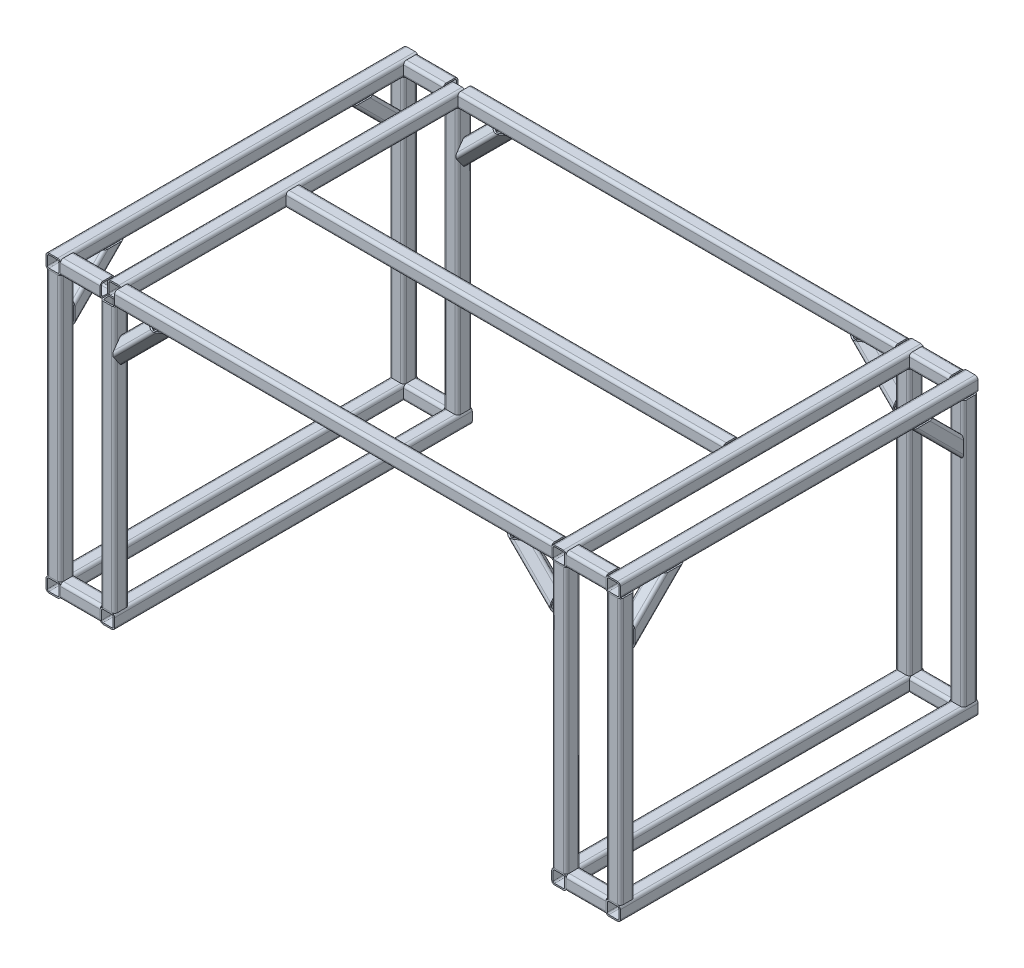
from build123d import *

# Parameters (mm, degrees)
SM_01_LOWER_FRAME_DEPTH         = 485
SM_01_LOWER_FRAME_DEPTH_BACK    = 10
SM_01_LOWER_FRAME_2_DEPTH       = 495
SM_01_LOWER_FRAME_3_DEPTH       = 77
SM_01_LOWER_FRAME_4_DEPTH       = 77
SM_01_LOWER_FRAME_5_DEPTH       = 495
SM_01_LOWER_FRAME_6_DEPTH       = 495
SM_01_LOWER_FRAME_7_DEPTH       = 77
SM_01_LOWER_FRAME_8_DEPTH       = 77
SM_02_UPPER_FRAME_START         = -247.5
SM_02_UPPER_FRAME_DEPTH         = 495
SM_02_UPPER_FRAME_START_2       = -377.5
SM_02_UPPER_FRAME_2_DEPTH       = 55
SM_02_UPPER_FRAME_3_DEPTH       = 55
SM_02_UPPER_FRAME_START_3       = 322.5
SM_02_UPPER_FRAME_4_DEPTH       = 55
SM_02_UPPER_FRAME_START_4       = -302.5
SM_02_UPPER_FRAME_5_DEPTH       = 605
SM_02_UPPER_FRAME_6_DEPTH       = 55
SM_02_UPPER_FRAME_7_DEPTH       = 495
SM_02_UPPER_FRAME_START_5       = -237.5
SM_02_UPPER_FRAME_8_DEPTH       = 475
SM_02_UPPER_FRAME_START_6       = -227.5
SM_02_UPPER_FRAME_9_DEPTH       = 455
SM_02_UPPER_FRAME_10_DEPTH      = 615
SM_02_UPPER_FRAME_11_DEPTH      = 615
SM_03_VERTICAL_SUPPORTS_DEPTH   = 387.5
SM_03_VERTICAL_SUPPORTS_2_DEPTH = 387.5
SM_03_VERTICAL_SUPPORTS_3_DEPTH = 387.5
SM_03_VERTICAL_SUPPORTS_4_DEPTH = 387.5
SM_03_VERTICAL_SUPPORTS_5_DEPTH = 387.5
SM_03_VERTICAL_SUPPORTS_6_DEPTH = 387.5
SM_03_VERTICAL_SUPPORTS_7_DEPTH = 387.5
SM_03_VERTICAL_SUPPORTS_8_DEPTH = 387.5
TR_04_EXTEND_1_RUN_ON           = 20
TR_04_EXTEND_1_OTHER_END_RUN_ON = 20
SM_04_UPPER_BRACES_START        = -106.066017178
SM_04_UPPER_BRACES_DEPTH        = 106.066017178
SM_04_UPPER_BRACES_2_DEPTH      = 106.066017178
SM_04_UPPER_BRACES_3_DEPTH      = 106.066017178
SM_04_UPPER_BRACES_4_DEPTH      = 106.066017178
SM_04_UPPER_BRACES_START_2      = 53.033008589
SM_04_UPPER_BRACES_5_DEPTH      = 106.066017178
SM_04_UPPER_BRACES_6_DEPTH      = 106.066017178
SM_04_UPPER_BRACES_7_DEPTH      = 106.066017178
SM_04_UPPER_BRACES_8_DEPTH      = 106.066017178


with BuildPart() as part:
    # Sketch1 → SM_01_Lower_Frame (new, two sides: drawn at the far end of the back side and taken through both)
    with BuildSketch(Plane(origin=(-387.5, 0, 237.5), x_dir=(-1, 0, 0), z_dir=(0, 0, -1)).offset(-SM_01_LOWER_FRAME_DEPTH_BACK)):
        with BuildLine():
            Line((-6, -10), (6, -10))
            ThreePointArc((6, -10), (8.828427125, -8.828427125), (10, -6))
            Line((10, -6), (10, 6))
            ThreePointArc((10, 6), (8.828427125, 8.828427125), (6, 10))
            Line((6, 10), (-6, 10))
            ThreePointArc((-6, 10), (-8.828427125, 8.828427125), (-10, 6))
            Line((-10, 6), (-10, -6))
            ThreePointArc((-10, -6), (-8.828427125, -8.828427125), (-6, -10))
        make_face()
        with BuildLine():
            Line((-6, -8), (6, -8))
            ThreePointArc((6, -8), (7.414213562, -7.414213562), (8, -6))
            Line((8, -6), (8, 6))
            ThreePointArc((8, 6), (7.414213562, 7.414213562), (6, 8))
            Line((6, 8), (-6, 8))
            ThreePointArc((-6, 8), (-7.414213562, 7.414213562), (-8, 6))
            Line((-8, 6), (-8, -6))
            ThreePointArc((-8, -6), (-7.414213562, -7.414213562), (-6, -8))
        make_face(mode=Mode.SUBTRACT)
    extrude(amount=SM_01_LOWER_FRAME_DEPTH + SM_01_LOWER_FRAME_DEPTH_BACK)


with BuildPart() as body_2:
    # Sketch1 on segment 2 (carried to segment 2) → SM_01_Lower_Frame 2 (new body)
    with BuildSketch(Plane(origin=(-312.5, 0, 247.5), x_dir=(-1, 0, 0), z_dir=(0, 0, -1))):
        with BuildLine():
            Line((-6, -10), (6, -10))
            ThreePointArc((6, -10), (8.828427125, -8.828427125), (10, -6))
            Line((10, -6), (10, 6))
            ThreePointArc((10, 6), (8.828427125, 8.828427125), (6, 10))
            Line((6, 10), (-6, 10))
            ThreePointArc((-6, 10), (-8.828427125, 8.828427125), (-10, 6))
            Line((-10, 6), (-10, -6))
            ThreePointArc((-10, -6), (-8.828427125, -8.828427125), (-6, -10))
        make_face()
        with BuildLine():
            Line((-6, -8), (6, -8))
            ThreePointArc((6, -8), (7.414213562, -7.414213562), (8, -6))
            Line((8, -6), (8, 6))
            ThreePointArc((8, 6), (7.414213562, 7.414213562), (6, 8))
            Line((6, 8), (-6, 8))
            ThreePointArc((-6, 8), (-7.414213562, 7.414213562), (-8, 6))
            Line((-8, 6), (-8, -6))
            ThreePointArc((-8, -6), (-7.414213562, -7.414213562), (-6, -8))
        make_face(mode=Mode.SUBTRACT)
    extrude(amount=SM_01_LOWER_FRAME_2_DEPTH)


with BuildPart() as body_3:
    # Sketch1 on segment 3 (carried to segment 3) → SM_01_Lower_Frame 3 (new body)
    with BuildSketch(Plane(origin=(-388.5, 0, 237.5), x_dir=(0, 0, -1), z_dir=(1, 0, 0))):
        with BuildLine():
            Line((-6, -10), (6, -10))
            ThreePointArc((6, -10), (8.828427125, -8.828427125), (10, -6))
            Line((10, -6), (10, 6))
            ThreePointArc((10, 6), (8.828427125, 8.828427125), (6, 10))
            Line((6, 10), (-6, 10))
            ThreePointArc((-6, 10), (-8.828427125, 8.828427125), (-10, 6))
            Line((-10, 6), (-10, -6))
            ThreePointArc((-10, -6), (-8.828427125, -8.828427125), (-6, -10))
        make_face()
        with BuildLine():
            Line((-6, -8), (6, -8))
            ThreePointArc((6, -8), (7.414213562, -7.414213562), (8, -6))
            Line((8, -6), (8, 6))
            ThreePointArc((8, 6), (7.414213562, 7.414213562), (6, 8))
            Line((6, 8), (-6, 8))
            ThreePointArc((-6, 8), (-7.414213562, 7.414213562), (-8, 6))
            Line((-8, 6), (-8, -6))
            ThreePointArc((-8, -6), (-7.414213562, -7.414213562), (-6, -8))
        make_face(mode=Mode.SUBTRACT)
    extrude(amount=SM_01_LOWER_FRAME_3_DEPTH)

    # SM_01_Lower_Frame 3 end butt 1
    split(bisect_by=Plane(origin=(-377.5, 0, 237.5), x_dir=(0, 1, 0), z_dir=(1, 0, 0)), keep=Keep.TOP)

    # SM_01_Lower_Frame 3 end butt 2
    split(bisect_by=Plane(origin=(-322.5, 0, 237.5), x_dir=(0, -1, 0), z_dir=(-1, 0, 0)), keep=Keep.TOP)


with BuildPart() as body_4:
    # Sketch1 on segment 4 (carried to segment 4) → SM_01_Lower_Frame 4 (new body)
    with BuildSketch(Plane(origin=(-388.5, 0, -237.5), x_dir=(0, 0, -1), z_dir=(1, 0, 0))):
        with BuildLine():
            Line((-6, -10), (6, -10))
            ThreePointArc((6, -10), (8.828427125, -8.828427125), (10, -6))
            Line((10, -6), (10, 6))
            ThreePointArc((10, 6), (8.828427125, 8.828427125), (6, 10))
            Line((6, 10), (-6, 10))
            ThreePointArc((-6, 10), (-8.828427125, 8.828427125), (-10, 6))
            Line((-10, 6), (-10, -6))
            ThreePointArc((-10, -6), (-8.828427125, -8.828427125), (-6, -10))
        make_face()
        with BuildLine():
            Line((-6, -8), (6, -8))
            ThreePointArc((6, -8), (7.414213562, -7.414213562), (8, -6))
            Line((8, -6), (8, 6))
            ThreePointArc((8, 6), (7.414213562, 7.414213562), (6, 8))
            Line((6, 8), (-6, 8))
            ThreePointArc((-6, 8), (-7.414213562, 7.414213562), (-8, 6))
            Line((-8, 6), (-8, -6))
            ThreePointArc((-8, -6), (-7.414213562, -7.414213562), (-6, -8))
        make_face(mode=Mode.SUBTRACT)
    extrude(amount=SM_01_LOWER_FRAME_4_DEPTH)

    # SM_01_Lower_Frame 4 end butt 1
    split(bisect_by=Plane(origin=(-377.5, 0, -237.5), x_dir=(0, 1, 0), z_dir=(1, 0, 0)), keep=Keep.TOP)

    # SM_01_Lower_Frame 4 end butt 2
    split(bisect_by=Plane(origin=(-322.5, 0, -237.5), x_dir=(0, -1, 0), z_dir=(-1, 0, 0)), keep=Keep.TOP)


with BuildPart() as body_5:
    # Sketch1 on segment 5 (carried to segment 5) → SM_01_Lower_Frame 5 (new body)
    with BuildSketch(Plane(origin=(312.5, 0, 247.5), x_dir=(-1, 0, 0), z_dir=(0, 0, -1))):
        with BuildLine():
            Line((-6, -10), (6, -10))
            ThreePointArc((6, -10), (8.828427125, -8.828427125), (10, -6))
            Line((10, -6), (10, 6))
            ThreePointArc((10, 6), (8.828427125, 8.828427125), (6, 10))
            Line((6, 10), (-6, 10))
            ThreePointArc((-6, 10), (-8.828427125, 8.828427125), (-10, 6))
            Line((-10, 6), (-10, -6))
            ThreePointArc((-10, -6), (-8.828427125, -8.828427125), (-6, -10))
        make_face()
        with BuildLine():
            Line((-6, -8), (6, -8))
            ThreePointArc((6, -8), (7.414213562, -7.414213562), (8, -6))
            Line((8, -6), (8, 6))
            ThreePointArc((8, 6), (7.414213562, 7.414213562), (6, 8))
            Line((6, 8), (-6, 8))
            ThreePointArc((-6, 8), (-7.414213562, 7.414213562), (-8, 6))
            Line((-8, 6), (-8, -6))
            ThreePointArc((-8, -6), (-7.414213562, -7.414213562), (-6, -8))
        make_face(mode=Mode.SUBTRACT)
    extrude(amount=SM_01_LOWER_FRAME_5_DEPTH)


with BuildPart() as body_6:
    # Sketch1 on segment 6 (carried to segment 6) → SM_01_Lower_Frame 6 (new body)
    with BuildSketch(Plane(origin=(387.5, 0, 247.5), x_dir=(-1, 0, 0), z_dir=(0, 0, -1))):
        with BuildLine():
            Line((-6, -10), (6, -10))
            ThreePointArc((6, -10), (8.828427125, -8.828427125), (10, -6))
            Line((10, -6), (10, 6))
            ThreePointArc((10, 6), (8.828427125, 8.828427125), (6, 10))
            Line((6, 10), (-6, 10))
            ThreePointArc((-6, 10), (-8.828427125, 8.828427125), (-10, 6))
            Line((-10, 6), (-10, -6))
            ThreePointArc((-10, -6), (-8.828427125, -8.828427125), (-6, -10))
        make_face()
        with BuildLine():
            Line((-6, -8), (6, -8))
            ThreePointArc((6, -8), (7.414213562, -7.414213562), (8, -6))
            Line((8, -6), (8, 6))
            ThreePointArc((8, 6), (7.414213562, 7.414213562), (6, 8))
            Line((6, 8), (-6, 8))
            ThreePointArc((-6, 8), (-7.414213562, 7.414213562), (-8, 6))
            Line((-8, 6), (-8, -6))
            ThreePointArc((-8, -6), (-7.414213562, -7.414213562), (-6, -8))
        make_face(mode=Mode.SUBTRACT)
    extrude(amount=SM_01_LOWER_FRAME_6_DEPTH)


with BuildPart() as body_7:
    # Sketch1 on segment 7 (carried to segment 7) → SM_01_Lower_Frame 7 (new body)
    with BuildSketch(Plane(origin=(388.5, 0, 237.5), x_dir=(0, 0, 1), z_dir=(-1, 0, 0))):
        with BuildLine():
            Line((-6, -10), (6, -10))
            ThreePointArc((6, -10), (8.828427125, -8.828427125), (10, -6))
            Line((10, -6), (10, 6))
            ThreePointArc((10, 6), (8.828427125, 8.828427125), (6, 10))
            Line((6, 10), (-6, 10))
            ThreePointArc((-6, 10), (-8.828427125, 8.828427125), (-10, 6))
            Line((-10, 6), (-10, -6))
            ThreePointArc((-10, -6), (-8.828427125, -8.828427125), (-6, -10))
        make_face()
        with BuildLine():
            Line((-6, -8), (6, -8))
            ThreePointArc((6, -8), (7.414213562, -7.414213562), (8, -6))
            Line((8, -6), (8, 6))
            ThreePointArc((8, 6), (7.414213562, 7.414213562), (6, 8))
            Line((6, 8), (-6, 8))
            ThreePointArc((-6, 8), (-7.414213562, 7.414213562), (-8, 6))
            Line((-8, 6), (-8, -6))
            ThreePointArc((-8, -6), (-7.414213562, -7.414213562), (-6, -8))
        make_face(mode=Mode.SUBTRACT)
    extrude(amount=SM_01_LOWER_FRAME_7_DEPTH)

    # SM_01_Lower_Frame 7 end butt 1
    split(bisect_by=Plane(origin=(377.5, 0, 237.5), x_dir=(0, -1, 0), z_dir=(-1, 0, 0)), keep=Keep.TOP)

    # SM_01_Lower_Frame 7 end butt 2
    split(bisect_by=Plane(origin=(322.5, 0, 237.5), x_dir=(0, 1, 0), z_dir=(1, 0, 0)), keep=Keep.TOP)


with BuildPart() as body_8:
    # Sketch1 on segment 8 (carried to segment 8) → SM_01_Lower_Frame 8 (new body)
    with BuildSketch(Plane(origin=(388.5, 0, -237.5), x_dir=(0, 0, 1), z_dir=(-1, 0, 0))):
        with BuildLine():
            Line((-6, -10), (6, -10))
            ThreePointArc((6, -10), (8.828427125, -8.828427125), (10, -6))
            Line((10, -6), (10, 6))
            ThreePointArc((10, 6), (8.828427125, 8.828427125), (6, 10))
            Line((6, 10), (-6, 10))
            ThreePointArc((-6, 10), (-8.828427125, 8.828427125), (-10, 6))
            Line((-10, 6), (-10, -6))
            ThreePointArc((-10, -6), (-8.828427125, -8.828427125), (-6, -10))
        make_face()
        with BuildLine():
            Line((-6, -8), (6, -8))
            ThreePointArc((6, -8), (7.414213562, -7.414213562), (8, -6))
            Line((8, -6), (8, 6))
            ThreePointArc((8, 6), (7.414213562, 7.414213562), (6, 8))
            Line((6, 8), (-6, 8))
            ThreePointArc((-6, 8), (-7.414213562, 7.414213562), (-8, 6))
            Line((-8, 6), (-8, -6))
            ThreePointArc((-8, -6), (-7.414213562, -7.414213562), (-6, -8))
        make_face(mode=Mode.SUBTRACT)
    extrude(amount=SM_01_LOWER_FRAME_8_DEPTH)

    # SM_01_Lower_Frame 8 end butt 1
    split(bisect_by=Plane(origin=(377.5, 0, -237.5), x_dir=(0, -1, 0), z_dir=(-1, 0, 0)), keep=Keep.TOP)

    # SM_01_Lower_Frame 8 end butt 2
    split(bisect_by=Plane(origin=(322.5, 0, -237.5), x_dir=(0, 1, 0), z_dir=(1, 0, 0)), keep=Keep.TOP)


with BuildPart() as body_9:
    # SM_02_Upper_Frame: read off the stored shape, not the designer's step
    # SM_02_Upper_Frame outline → SM_02_Upper_Frame (new body)
    with BuildSketch(Plane.XY.offset(SM_02_UPPER_FRAME_START)):
        with BuildLine():
            Line((-381.5, 397.5), (-393.5, 397.5))
            ThreePointArc((-393.5, 397.5), (-396.328427125, 396.328427125), (-397.5, 393.5))
            Line((-397.5, 393.5), (-397.5, 381.5))
            ThreePointArc((-397.5, 381.5), (-396.328427125, 378.671572875), (-393.5, 377.5))
            Line((-393.5, 377.5), (-381.5, 377.5))
            ThreePointArc((-381.5, 377.5), (-378.671572875, 378.671572875), (-377.5, 381.5))
            Line((-377.5, 381.5), (-377.5, 393.5))
            ThreePointArc((-377.5, 393.5), (-378.671572875, 396.328427125), (-381.5, 397.5))
        make_face()
        with BuildLine():
            ThreePointArc((-381.5, 395.5), (-380.085786438, 394.914213562), (-379.5, 393.5))
            Line((-379.5, 393.5), (-379.5, 381.5))
            ThreePointArc((-379.5, 381.5), (-380.085786438, 380.085786438), (-381.5, 379.5))
            Line((-381.5, 379.5), (-393.5, 379.5))
            ThreePointArc((-393.5, 379.5), (-394.914213562, 380.085786438), (-395.5, 381.5))
            Line((-395.5, 381.5), (-395.5, 393.5))
            ThreePointArc((-395.5, 393.5), (-394.914213562, 394.914213562), (-393.5, 395.5))
            Line((-393.5, 395.5), (-381.5, 395.5))
        make_face(mode=Mode.SUBTRACT)
    extrude(amount=SM_02_UPPER_FRAME_DEPTH)


with BuildPart() as body_10:
    # SM_02_Upper_Frame 2 outline → SM_02_Upper_Frame 2 (new body)
    with BuildSketch(Plane.YZ.offset(SM_02_UPPER_FRAME_START_2)):
        with BuildLine():
            Line((381.5, 227.5), (393.5, 227.5))
            ThreePointArc((393.5, 227.5), (396.328427125, 228.671572875), (397.5, 231.5))
            Line((397.5, 231.5), (397.5, 243.5))
            ThreePointArc((397.5, 243.5), (396.328427125, 246.328427125), (393.5, 247.5))
            Line((393.5, 247.5), (381.5, 247.5))
            ThreePointArc((381.5, 247.5), (378.671572875, 246.328427125), (377.5, 243.5))
            Line((377.5, 243.5), (377.5, 231.5))
            ThreePointArc((377.5, 231.5), (378.671572875, 228.671572875), (381.5, 227.5))
        make_face()
        with BuildLine():
            ThreePointArc((379.5, 243.5), (380.085786438, 244.914213562), (381.5, 245.5))
            Line((381.5, 245.5), (393.5, 245.5))
            ThreePointArc((393.5, 245.5), (394.914213562, 244.914213562), (395.5, 243.5))
            Line((395.5, 243.5), (395.5, 231.5))
            ThreePointArc((395.5, 231.5), (394.914213562, 230.085786438), (393.5, 229.5))
            Line((393.5, 229.5), (381.5, 229.5))
            ThreePointArc((381.5, 229.5), (380.085786438, 230.085786438), (379.5, 231.5))
            Line((379.5, 231.5), (379.5, 243.5))
        make_face(mode=Mode.SUBTRACT)
    extrude(amount=SM_02_UPPER_FRAME_2_DEPTH)


with BuildPart() as body_11:
    # SM_02_Upper_Frame 3 outline → SM_02_Upper_Frame 3 (new body)
    with BuildSketch(Plane.YZ.offset(SM_02_UPPER_FRAME_START_2)):
        with BuildLine():
            Line((381.5, -247.5), (393.5, -247.5))
            ThreePointArc((393.5, -247.5), (396.328427125, -246.328427125), (397.5, -243.5))
            Line((397.5, -243.5), (397.5, -231.5))
            ThreePointArc((397.5, -231.5), (396.328427125, -228.671572875), (393.5, -227.5))
            Line((393.5, -227.5), (381.5, -227.5))
            ThreePointArc((381.5, -227.5), (378.671572875, -228.671572875), (377.5, -231.5))
            Line((377.5, -231.5), (377.5, -243.5))
            ThreePointArc((377.5, -243.5), (378.671572875, -246.328427125), (381.5, -247.5))
        make_face()
        with BuildLine():
            ThreePointArc((379.5, -231.5), (380.085786438, -230.085786438), (381.5, -229.5))
            Line((381.5, -229.5), (393.5, -229.5))
            ThreePointArc((393.5, -229.5), (394.914213562, -230.085786438), (395.5, -231.5))
            Line((395.5, -231.5), (395.5, -243.5))
            ThreePointArc((395.5, -243.5), (394.914213562, -244.914213562), (393.5, -245.5))
            Line((393.5, -245.5), (381.5, -245.5))
            ThreePointArc((381.5, -245.5), (380.085786438, -244.914213562), (379.5, -243.5))
            Line((379.5, -243.5), (379.5, -231.5))
        make_face(mode=Mode.SUBTRACT)
    extrude(amount=SM_02_UPPER_FRAME_3_DEPTH)


with BuildPart() as body_12:
    # SM_02_Upper_Frame 4 outline → SM_02_Upper_Frame 4 (new body)
    with BuildSketch(Plane.YZ.offset(SM_02_UPPER_FRAME_START_3)):
        with BuildLine():
            Line((393.5, -227.5), (381.5, -227.5))
            ThreePointArc((381.5, -227.5), (378.671572875, -228.671572875), (377.5, -231.5))
            Line((377.5, -231.5), (377.5, -243.5))
            ThreePointArc((377.5, -243.5), (378.671572875, -246.328427125), (381.5, -247.5))
            Line((381.5, -247.5), (393.5, -247.5))
            ThreePointArc((393.5, -247.5), (396.328427125, -246.328427125), (397.5, -243.5))
            Line((397.5, -243.5), (397.5, -231.5))
            ThreePointArc((397.5, -231.5), (396.328427125, -228.671572875), (393.5, -227.5))
        make_face()
        with BuildLine():
            ThreePointArc((395.5, -243.5), (394.914213562, -244.914213562), (393.5, -245.5))
            Line((393.5, -245.5), (381.5, -245.5))
            ThreePointArc((381.5, -245.5), (380.085786438, -244.914213562), (379.5, -243.5))
            Line((379.5, -243.5), (379.5, -231.5))
            ThreePointArc((379.5, -231.5), (380.085786438, -230.085786438), (381.5, -229.5))
            Line((381.5, -229.5), (393.5, -229.5))
            ThreePointArc((393.5, -229.5), (394.914213562, -230.085786438), (395.5, -231.5))
            Line((395.5, -231.5), (395.5, -243.5))
        make_face(mode=Mode.SUBTRACT)
    extrude(amount=SM_02_UPPER_FRAME_4_DEPTH)


with BuildPart() as body_13:
    # SM_02_Upper_Frame 5 outline → SM_02_Upper_Frame 5 (new body)
    with BuildSketch(Plane.YZ.offset(SM_02_UPPER_FRAME_START_4)):
        with BuildLine():
            Line((381.5, -10), (393.5, -10))
            ThreePointArc((393.5, -10), (396.328427125, -8.828427125), (397.5, -6))
            Line((397.5, -6), (397.5, 6))
            ThreePointArc((397.5, 6), (396.328427125, 8.828427125), (393.5, 10))
            Line((393.5, 10), (381.5, 10))
            ThreePointArc((381.5, 10), (378.671572875, 8.828427125), (377.5, 6))
            Line((377.5, 6), (377.5, -6))
            ThreePointArc((377.5, -6), (378.671572875, -8.828427125), (381.5, -10))
        make_face()
        with BuildLine():
            ThreePointArc((379.5, 6), (380.085786438, 7.414213562), (381.5, 8))
            Line((381.5, 8), (393.5, 8))
            ThreePointArc((393.5, 8), (394.914213562, 7.414213562), (395.5, 6))
            Line((395.5, 6), (395.5, -6))
            ThreePointArc((395.5, -6), (394.914213562, -7.414213562), (393.5, -8))
            Line((393.5, -8), (381.5, -8))
            ThreePointArc((381.5, -8), (380.085786438, -7.414213562), (379.5, -6))
            Line((379.5, -6), (379.5, 6))
        make_face(mode=Mode.SUBTRACT)
    extrude(amount=SM_02_UPPER_FRAME_5_DEPTH)


with BuildPart() as body_14:
    # SM_02_Upper_Frame 6 outline → SM_02_Upper_Frame 6 (new body)
    with BuildSketch(Plane.YZ.offset(SM_02_UPPER_FRAME_START_3)):
        with BuildLine():
            Line((393.5, 247.5), (381.5, 247.5))
            ThreePointArc((381.5, 247.5), (378.671572875, 246.328427125), (377.5, 243.5))
            Line((377.5, 243.5), (377.5, 231.5))
            ThreePointArc((377.5, 231.5), (378.671572875, 228.671572875), (381.5, 227.5))
            Line((381.5, 227.5), (393.5, 227.5))
            ThreePointArc((393.5, 227.5), (396.328427125, 228.671572875), (397.5, 231.5))
            Line((397.5, 231.5), (397.5, 243.5))
            ThreePointArc((397.5, 243.5), (396.328427125, 246.328427125), (393.5, 247.5))
        make_face()
        with BuildLine():
            ThreePointArc((395.5, 231.5), (394.914213562, 230.085786438), (393.5, 229.5))
            Line((393.5, 229.5), (381.5, 229.5))
            ThreePointArc((381.5, 229.5), (380.085786438, 230.085786438), (379.5, 231.5))
            Line((379.5, 231.5), (379.5, 243.5))
            ThreePointArc((379.5, 243.5), (380.085786438, 244.914213562), (381.5, 245.5))
            Line((381.5, 245.5), (393.5, 245.5))
            ThreePointArc((393.5, 245.5), (394.914213562, 244.914213562), (395.5, 243.5))
            Line((395.5, 243.5), (395.5, 231.5))
        make_face(mode=Mode.SUBTRACT)
    extrude(amount=SM_02_UPPER_FRAME_6_DEPTH)


with BuildPart() as body_15:
    # SM_02_Upper_Frame 7 outline → SM_02_Upper_Frame 7 (new body)
    with BuildSketch(Plane.XY.offset(SM_02_UPPER_FRAME_START)):
        with BuildLine():
            Line((393.5, 397.5), (381.5, 397.5))
            ThreePointArc((381.5, 397.5), (378.671572875, 396.328427125), (377.5, 393.5))
            Line((377.5, 393.5), (377.5, 381.5))
            ThreePointArc((377.5, 381.5), (378.671572875, 378.671572875), (381.5, 377.5))
            Line((381.5, 377.5), (393.5, 377.5))
            ThreePointArc((393.5, 377.5), (396.328427125, 378.671572875), (397.5, 381.5))
            Line((397.5, 381.5), (397.5, 393.5))
            ThreePointArc((397.5, 393.5), (396.328427125, 396.328427125), (393.5, 397.5))
        make_face()
        with BuildLine():
            ThreePointArc((393.5, 395.5), (394.914213562, 394.914213562), (395.5, 393.5))
            Line((395.5, 393.5), (395.5, 381.5))
            ThreePointArc((395.5, 381.5), (394.914213562, 380.085786438), (393.5, 379.5))
            Line((393.5, 379.5), (381.5, 379.5))
            ThreePointArc((381.5, 379.5), (380.085786438, 380.085786438), (379.5, 381.5))
            Line((379.5, 381.5), (379.5, 393.5))
            ThreePointArc((379.5, 393.5), (380.085786438, 394.914213562), (381.5, 395.5))
            Line((381.5, 395.5), (393.5, 395.5))
        make_face(mode=Mode.SUBTRACT)
    extrude(amount=SM_02_UPPER_FRAME_7_DEPTH)


with BuildPart() as body_16:
    # SM_02_Upper_Frame 8 outline → SM_02_Upper_Frame 8 (new body)
    with BuildSketch(Plane.XY.offset(SM_02_UPPER_FRAME_START_5)):
        with BuildLine():
            Line((-306.5, 397.5), (-318.5, 397.5))
            ThreePointArc((-318.5, 397.5), (-321.328427125, 396.328427125), (-322.5, 393.5))
            Line((-322.5, 393.5), (-322.5, 381.5))
            ThreePointArc((-322.5, 381.5), (-321.328427125, 378.671572875), (-318.5, 377.5))
            Line((-318.5, 377.5), (-306.5, 377.5))
            ThreePointArc((-306.5, 377.5), (-303.671572875, 378.671572875), (-302.5, 381.5))
            Line((-302.5, 381.5), (-302.5, 393.5))
            ThreePointArc((-302.5, 393.5), (-303.671572875, 396.328427125), (-306.5, 397.5))
        make_face()
        with BuildLine():
            ThreePointArc((-306.5, 395.5), (-305.085786438, 394.914213562), (-304.5, 393.5))
            Line((-304.5, 393.5), (-304.5, 381.5))
            ThreePointArc((-304.5, 381.5), (-305.085786438, 380.085786438), (-306.5, 379.5))
            Line((-306.5, 379.5), (-318.5, 379.5))
            ThreePointArc((-318.5, 379.5), (-319.914213562, 380.085786438), (-320.5, 381.5))
            Line((-320.5, 381.5), (-320.5, 393.5))
            ThreePointArc((-320.5, 393.5), (-319.914213562, 394.914213562), (-318.5, 395.5))
            Line((-318.5, 395.5), (-306.5, 395.5))
        make_face(mode=Mode.SUBTRACT)
    extrude(amount=SM_02_UPPER_FRAME_8_DEPTH)


with BuildPart() as body_17:
    # SM_02_Upper_Frame 9 outline → SM_02_Upper_Frame 9 (new body)
    with BuildSketch(Plane.XY.offset(SM_02_UPPER_FRAME_START_6)):
        with BuildLine():
            Line((302.5, 393.5), (302.5, 381.5))
            ThreePointArc((302.5, 381.5), (303.671572875, 378.671572875), (306.5, 377.5))
            Line((306.5, 377.5), (318.5, 377.5))
            ThreePointArc((318.5, 377.5), (321.328427125, 378.671572875), (322.5, 381.5))
            Line((322.5, 381.5), (322.5, 393.5))
            ThreePointArc((322.5, 393.5), (321.328427125, 396.328427125), (318.5, 397.5))
            Line((318.5, 397.5), (306.5, 397.5))
            ThreePointArc((306.5, 397.5), (303.671572875, 396.328427125), (302.5, 393.5))
        make_face()
        with BuildLine():
            ThreePointArc((318.5, 395.5), (319.914213562, 394.914213562), (320.5, 393.5))
            Line((320.5, 393.5), (320.5, 381.5))
            ThreePointArc((320.5, 381.5), (319.914213562, 380.085786438), (318.5, 379.5))
            Line((318.5, 379.5), (306.5, 379.5))
            ThreePointArc((306.5, 379.5), (305.085786438, 380.085786438), (304.5, 381.5))
            Line((304.5, 381.5), (304.5, 393.5))
            ThreePointArc((304.5, 393.5), (305.085786438, 394.914213562), (306.5, 395.5))
            Line((306.5, 395.5), (318.5, 395.5))
        make_face(mode=Mode.SUBTRACT)
    extrude(amount=SM_02_UPPER_FRAME_9_DEPTH)

    # TR_04 extend 1: the member runs on so that the trim can cut it back to the boundary (SolidWorks' 'allow extension')
    extrude(body_17.faces().sort_by_distance((304.5, 379.5, 227.5))[0], amount=TR_04_EXTEND_1_RUN_ON, dir=(0, 0, 1))

    # TR_04 extend 1 other end: the member runs on so that the trim can cut it back to the boundary (SolidWorks' 'allow extension')
    extrude(body_17.faces().sort_by_distance((304.5, 379.5, -227.5))[0], amount=TR_04_EXTEND_1_OTHER_END_RUN_ON, dir=(0, 0, -1))


with BuildPart() as body_18:
    # SM_02_Upper_Frame 10 outline → SM_02_Upper_Frame 10 (new body)
    with BuildSketch(Plane.YZ.offset(SM_02_UPPER_FRAME_START_4)):
        with BuildLine():
            ThreePointArc((393.5, -247.5), (396.328427125, -246.328427125), (397.5, -243.5))
            Line((397.5, -243.5), (397.5, -231.5))
            ThreePointArc((397.5, -231.5), (396.328427125, -228.671572875), (393.5, -227.5))
            Line((393.5, -227.5), (381.5, -227.5))
            ThreePointArc((381.5, -227.5), (378.671572875, -228.671572875), (377.5, -231.5))
            Line((377.5, -231.5), (377.5, -243.5))
            ThreePointArc((377.5, -243.5), (378.671572875, -246.328427125), (381.5, -247.5))
            Line((381.5, -247.5), (393.5, -247.5))
        make_face()
        with BuildLine():
            Line((381.5, -229.5), (393.5, -229.5))
            ThreePointArc((393.5, -229.5), (394.914213562, -230.085786438), (395.5, -231.5))
            Line((395.5, -231.5), (395.5, -243.5))
            ThreePointArc((395.5, -243.5), (394.914213562, -244.914213562), (393.5, -245.5))
            Line((393.5, -245.5), (381.5, -245.5))
            ThreePointArc((381.5, -245.5), (380.085786438, -244.914213562), (379.5, -243.5))
            Line((379.5, -243.5), (379.5, -231.5))
            ThreePointArc((379.5, -231.5), (380.085786438, -230.085786438), (381.5, -229.5))
        make_face(mode=Mode.SUBTRACT)
    extrude(amount=SM_02_UPPER_FRAME_10_DEPTH)

    # TR_03_Middle_Upper
    split(bisect_by=Plane(origin=(302.5, 387.5, 0), x_dir=(0, -1, 0), z_dir=(-1, 0, 0)), keep=Keep.TOP)


with BuildPart() as body_19:
    # SM_02_Upper_Frame 11 outline → SM_02_Upper_Frame 11 (new body)
    with BuildSketch(Plane.YZ.offset(SM_02_UPPER_FRAME_START_4)):
        with BuildLine():
            ThreePointArc((393.5, 227.5), (396.328427125, 228.671572875), (397.5, 231.5))
            Line((397.5, 231.5), (397.5, 243.5))
            ThreePointArc((397.5, 243.5), (396.328427125, 246.328427125), (393.5, 247.5))
            Line((393.5, 247.5), (381.5, 247.5))
            ThreePointArc((381.5, 247.5), (378.671572875, 246.328427125), (377.5, 243.5))
            Line((377.5, 243.5), (377.5, 231.5))
            ThreePointArc((377.5, 231.5), (378.671572875, 228.671572875), (381.5, 227.5))
            Line((381.5, 227.5), (393.5, 227.5))
        make_face()
        with BuildLine():
            Line((381.5, 245.5), (393.5, 245.5))
            ThreePointArc((393.5, 245.5), (394.914213562, 244.914213562), (395.5, 243.5))
            Line((395.5, 243.5), (395.5, 231.5))
            ThreePointArc((395.5, 231.5), (394.914213562, 230.085786438), (393.5, 229.5))
            Line((393.5, 229.5), (381.5, 229.5))
            ThreePointArc((381.5, 229.5), (380.085786438, 230.085786438), (379.5, 231.5))
            Line((379.5, 231.5), (379.5, 243.5))
            ThreePointArc((379.5, 243.5), (380.085786438, 244.914213562), (381.5, 245.5))
        make_face(mode=Mode.SUBTRACT)
    extrude(amount=SM_02_UPPER_FRAME_11_DEPTH)

    # TR_03_Middle_Upper
    split(bisect_by=Plane(origin=(302.5, 387.5, 0), x_dir=(0, -1, 0), z_dir=(-1, 0, 0)), keep=Keep.TOP)


with BuildPart() as body_20:
    # Sketch12 → SM_03_Vertical_Supports (new body)
    with BuildSketch(Plane(origin=(-387.5, 387.5, 237.5), x_dir=(1, 0, 0), z_dir=(0, -1, 0))):
        with BuildLine():
            Line((-6, -10), (6, -10))
            ThreePointArc((6, -10), (8.828427125, -8.828427125), (10, -6))
            Line((10, -6), (10, 6))
            ThreePointArc((10, 6), (8.828427125, 8.828427125), (6, 10))
            Line((6, 10), (-6, 10))
            ThreePointArc((-6, 10), (-8.828427125, 8.828427125), (-10, 6))
            Line((-10, 6), (-10, -6))
            ThreePointArc((-10, -6), (-8.828427125, -8.828427125), (-6, -10))
        make_face()
        with BuildLine():
            Line((-6, -8), (6, -8))
            ThreePointArc((6, -8), (7.414213562, -7.414213562), (8, -6))
            Line((8, -6), (8, 6))
            ThreePointArc((8, 6), (7.414213562, 7.414213562), (6, 8))
            Line((6, 8), (-6, 8))
            ThreePointArc((-6, 8), (-7.414213562, 7.414213562), (-8, 6))
            Line((-8, 6), (-8, -6))
            ThreePointArc((-8, -6), (-7.414213562, -7.414213562), (-6, -8))
        make_face(mode=Mode.SUBTRACT)
    extrude(amount=SM_03_VERTICAL_SUPPORTS_DEPTH)

    # TR_01_Upper_Joints
    split(bisect_by=Plane(origin=(-350, 377.5, 237.5), x_dir=(1, 0, 0), z_dir=(0, -1, 0)), keep=Keep.TOP)

    # TR_02_Lower_Joints
    split(bisect_by=Plane(origin=(-350, 10, 237.5), x_dir=(-1, 0, 0), z_dir=(0, 1, 0)), keep=Keep.TOP)


with BuildPart() as body_21:
    # Sketch12 on segment 2 (carried to segment 2) → SM_03_Vertical_Supports 2 (new body)
    with BuildSketch(Plane(origin=(-312.5, 387.5, 237.5), x_dir=(1, 0, 0), z_dir=(0, -1, 0))):
        with BuildLine():
            Line((-6, -10), (6, -10))
            ThreePointArc((6, -10), (8.828427125, -8.828427125), (10, -6))
            Line((10, -6), (10, 6))
            ThreePointArc((10, 6), (8.828427125, 8.828427125), (6, 10))
            Line((6, 10), (-6, 10))
            ThreePointArc((-6, 10), (-8.828427125, 8.828427125), (-10, 6))
            Line((-10, 6), (-10, -6))
            ThreePointArc((-10, -6), (-8.828427125, -8.828427125), (-6, -10))
        make_face()
        with BuildLine():
            Line((-6, -8), (6, -8))
            ThreePointArc((6, -8), (7.414213562, -7.414213562), (8, -6))
            Line((8, -6), (8, 6))
            ThreePointArc((8, 6), (7.414213562, 7.414213562), (6, 8))
            Line((6, 8), (-6, 8))
            ThreePointArc((-6, 8), (-7.414213562, 7.414213562), (-8, 6))
            Line((-8, 6), (-8, -6))
            ThreePointArc((-8, -6), (-7.414213562, -7.414213562), (-6, -8))
        make_face(mode=Mode.SUBTRACT)
    extrude(amount=SM_03_VERTICAL_SUPPORTS_2_DEPTH)

    # TR_01_Upper_Joints
    split(bisect_by=Plane(origin=(-350, 377.5, 237.5), x_dir=(1, 0, 0), z_dir=(0, -1, 0)), keep=Keep.TOP)

    # TR_02_Lower_Joints
    split(bisect_by=Plane(origin=(-350, 10, 237.5), x_dir=(-1, 0, 0), z_dir=(0, 1, 0)), keep=Keep.TOP)


with BuildPart() as body_22:
    # Sketch12 on segment 3 (carried to segment 3) → SM_03_Vertical_Supports 3 (new body)
    with BuildSketch(Plane(origin=(-387.5, 387.5, -237.5), x_dir=(1, 0, 0), z_dir=(0, -1, 0))):
        with BuildLine():
            Line((-6, -10), (6, -10))
            ThreePointArc((6, -10), (8.828427125, -8.828427125), (10, -6))
            Line((10, -6), (10, 6))
            ThreePointArc((10, 6), (8.828427125, 8.828427125), (6, 10))
            Line((6, 10), (-6, 10))
            ThreePointArc((-6, 10), (-8.828427125, 8.828427125), (-10, 6))
            Line((-10, 6), (-10, -6))
            ThreePointArc((-10, -6), (-8.828427125, -8.828427125), (-6, -10))
        make_face()
        with BuildLine():
            Line((-6, -8), (6, -8))
            ThreePointArc((6, -8), (7.414213562, -7.414213562), (8, -6))
            Line((8, -6), (8, 6))
            ThreePointArc((8, 6), (7.414213562, 7.414213562), (6, 8))
            Line((6, 8), (-6, 8))
            ThreePointArc((-6, 8), (-7.414213562, 7.414213562), (-8, 6))
            Line((-8, 6), (-8, -6))
            ThreePointArc((-8, -6), (-7.414213562, -7.414213562), (-6, -8))
        make_face(mode=Mode.SUBTRACT)
    extrude(amount=SM_03_VERTICAL_SUPPORTS_3_DEPTH)

    # TR_01_Upper_Joints
    split(bisect_by=Plane(origin=(-350, 377.5, 237.5), x_dir=(1, 0, 0), z_dir=(0, -1, 0)), keep=Keep.TOP)

    # TR_02_Lower_Joints
    split(bisect_by=Plane(origin=(-350, 10, 237.5), x_dir=(-1, 0, 0), z_dir=(0, 1, 0)), keep=Keep.TOP)


with BuildPart() as body_23:
    # Sketch12 on segment 4 (carried to segment 4) → SM_03_Vertical_Supports 4 (new body)
    with BuildSketch(Plane(origin=(-312.5, 387.5, -237.5), x_dir=(1, 0, 0), z_dir=(0, -1, 0))):
        with BuildLine():
            Line((-6, -10), (6, -10))
            ThreePointArc((6, -10), (8.828427125, -8.828427125), (10, -6))
            Line((10, -6), (10, 6))
            ThreePointArc((10, 6), (8.828427125, 8.828427125), (6, 10))
            Line((6, 10), (-6, 10))
            ThreePointArc((-6, 10), (-8.828427125, 8.828427125), (-10, 6))
            Line((-10, 6), (-10, -6))
            ThreePointArc((-10, -6), (-8.828427125, -8.828427125), (-6, -10))
        make_face()
        with BuildLine():
            Line((-6, -8), (6, -8))
            ThreePointArc((6, -8), (7.414213562, -7.414213562), (8, -6))
            Line((8, -6), (8, 6))
            ThreePointArc((8, 6), (7.414213562, 7.414213562), (6, 8))
            Line((6, 8), (-6, 8))
            ThreePointArc((-6, 8), (-7.414213562, 7.414213562), (-8, 6))
            Line((-8, 6), (-8, -6))
            ThreePointArc((-8, -6), (-7.414213562, -7.414213562), (-6, -8))
        make_face(mode=Mode.SUBTRACT)
    extrude(amount=SM_03_VERTICAL_SUPPORTS_4_DEPTH)

    # TR_01_Upper_Joints
    split(bisect_by=Plane(origin=(-350, 377.5, 237.5), x_dir=(1, 0, 0), z_dir=(0, -1, 0)), keep=Keep.TOP)

    # TR_02_Lower_Joints
    split(bisect_by=Plane(origin=(-350, 10, 237.5), x_dir=(-1, 0, 0), z_dir=(0, 1, 0)), keep=Keep.TOP)


with BuildPart() as body_24:
    # Sketch12 on segment 5 (carried to segment 5) → SM_03_Vertical_Supports 5 (new body)
    with BuildSketch(Plane(origin=(312.5, 387.5, -237.5), x_dir=(1, 0, 0), z_dir=(0, -1, 0))):
        with BuildLine():
            Line((-6, -10), (6, -10))
            ThreePointArc((6, -10), (8.828427125, -8.828427125), (10, -6))
            Line((10, -6), (10, 6))
            ThreePointArc((10, 6), (8.828427125, 8.828427125), (6, 10))
            Line((6, 10), (-6, 10))
            ThreePointArc((-6, 10), (-8.828427125, 8.828427125), (-10, 6))
            Line((-10, 6), (-10, -6))
            ThreePointArc((-10, -6), (-8.828427125, -8.828427125), (-6, -10))
        make_face()
        with BuildLine():
            Line((-6, -8), (6, -8))
            ThreePointArc((6, -8), (7.414213562, -7.414213562), (8, -6))
            Line((8, -6), (8, 6))
            ThreePointArc((8, 6), (7.414213562, 7.414213562), (6, 8))
            Line((6, 8), (-6, 8))
            ThreePointArc((-6, 8), (-7.414213562, 7.414213562), (-8, 6))
            Line((-8, 6), (-8, -6))
            ThreePointArc((-8, -6), (-7.414213562, -7.414213562), (-6, -8))
        make_face(mode=Mode.SUBTRACT)
    extrude(amount=SM_03_VERTICAL_SUPPORTS_5_DEPTH)

    # TR_01_Upper_Joints
    split(bisect_by=Plane(origin=(-350, 377.5, 237.5), x_dir=(1, 0, 0), z_dir=(0, -1, 0)), keep=Keep.TOP)

    # TR_02_Lower_Joints
    split(bisect_by=Plane(origin=(-350, 10, 237.5), x_dir=(-1, 0, 0), z_dir=(0, 1, 0)), keep=Keep.TOP)


with BuildPart() as body_25:
    # Sketch12 on segment 6 (carried to segment 6) → SM_03_Vertical_Supports 6 (new body)
    with BuildSketch(Plane(origin=(387.5, 387.5, -237.5), x_dir=(1, 0, 0), z_dir=(0, -1, 0))):
        with BuildLine():
            Line((-6, -10), (6, -10))
            ThreePointArc((6, -10), (8.828427125, -8.828427125), (10, -6))
            Line((10, -6), (10, 6))
            ThreePointArc((10, 6), (8.828427125, 8.828427125), (6, 10))
            Line((6, 10), (-6, 10))
            ThreePointArc((-6, 10), (-8.828427125, 8.828427125), (-10, 6))
            Line((-10, 6), (-10, -6))
            ThreePointArc((-10, -6), (-8.828427125, -8.828427125), (-6, -10))
        make_face()
        with BuildLine():
            Line((-6, -8), (6, -8))
            ThreePointArc((6, -8), (7.414213562, -7.414213562), (8, -6))
            Line((8, -6), (8, 6))
            ThreePointArc((8, 6), (7.414213562, 7.414213562), (6, 8))
            Line((6, 8), (-6, 8))
            ThreePointArc((-6, 8), (-7.414213562, 7.414213562), (-8, 6))
            Line((-8, 6), (-8, -6))
            ThreePointArc((-8, -6), (-7.414213562, -7.414213562), (-6, -8))
        make_face(mode=Mode.SUBTRACT)
    extrude(amount=SM_03_VERTICAL_SUPPORTS_6_DEPTH)

    # TR_01_Upper_Joints
    split(bisect_by=Plane(origin=(-350, 377.5, 237.5), x_dir=(1, 0, 0), z_dir=(0, -1, 0)), keep=Keep.TOP)

    # TR_02_Lower_Joints
    split(bisect_by=Plane(origin=(-350, 10, 237.5), x_dir=(-1, 0, 0), z_dir=(0, 1, 0)), keep=Keep.TOP)


with BuildPart() as body_26:
    # Sketch12 on segment 7 (carried to segment 7) → SM_03_Vertical_Supports 7 (new body)
    with BuildSketch(Plane(origin=(312.5, 387.5, 237.5), x_dir=(1, 0, 0), z_dir=(0, -1, 0))):
        with BuildLine():
            Line((-6, -10), (6, -10))
            ThreePointArc((6, -10), (8.828427125, -8.828427125), (10, -6))
            Line((10, -6), (10, 6))
            ThreePointArc((10, 6), (8.828427125, 8.828427125), (6, 10))
            Line((6, 10), (-6, 10))
            ThreePointArc((-6, 10), (-8.828427125, 8.828427125), (-10, 6))
            Line((-10, 6), (-10, -6))
            ThreePointArc((-10, -6), (-8.828427125, -8.828427125), (-6, -10))
        make_face()
        with BuildLine():
            Line((-6, -8), (6, -8))
            ThreePointArc((6, -8), (7.414213562, -7.414213562), (8, -6))
            Line((8, -6), (8, 6))
            ThreePointArc((8, 6), (7.414213562, 7.414213562), (6, 8))
            Line((6, 8), (-6, 8))
            ThreePointArc((-6, 8), (-7.414213562, 7.414213562), (-8, 6))
            Line((-8, 6), (-8, -6))
            ThreePointArc((-8, -6), (-7.414213562, -7.414213562), (-6, -8))
        make_face(mode=Mode.SUBTRACT)
    extrude(amount=SM_03_VERTICAL_SUPPORTS_7_DEPTH)

    # TR_01_Upper_Joints
    split(bisect_by=Plane(origin=(-350, 377.5, 237.5), x_dir=(1, 0, 0), z_dir=(0, -1, 0)), keep=Keep.TOP)

    # TR_02_Lower_Joints
    split(bisect_by=Plane(origin=(-350, 10, 237.5), x_dir=(-1, 0, 0), z_dir=(0, 1, 0)), keep=Keep.TOP)


with BuildPart() as body_27:
    # Sketch12 on segment 8 (carried to segment 8) → SM_03_Vertical_Supports 8 (new body)
    with BuildSketch(Plane(origin=(387.5, 387.5, 237.5), x_dir=(1, 0, 0), z_dir=(0, -1, 0))):
        with BuildLine():
            Line((-6, -10), (6, -10))
            ThreePointArc((6, -10), (8.828427125, -8.828427125), (10, -6))
            Line((10, -6), (10, 6))
            ThreePointArc((10, 6), (8.828427125, 8.828427125), (6, 10))
            Line((6, 10), (-6, 10))
            ThreePointArc((-6, 10), (-8.828427125, 8.828427125), (-10, 6))
            Line((-10, 6), (-10, -6))
            ThreePointArc((-10, -6), (-8.828427125, -8.828427125), (-6, -10))
        make_face()
        with BuildLine():
            Line((-6, -8), (6, -8))
            ThreePointArc((6, -8), (7.414213562, -7.414213562), (8, -6))
            Line((8, -6), (8, 6))
            ThreePointArc((8, 6), (7.414213562, 7.414213562), (6, 8))
            Line((6, 8), (-6, 8))
            ThreePointArc((-6, 8), (-7.414213562, 7.414213562), (-8, 6))
            Line((-8, 6), (-8, -6))
            ThreePointArc((-8, -6), (-7.414213562, -7.414213562), (-6, -8))
        make_face(mode=Mode.SUBTRACT)
    extrude(amount=SM_03_VERTICAL_SUPPORTS_8_DEPTH)

    # TR_01_Upper_Joints
    split(bisect_by=Plane(origin=(-350, 377.5, 237.5), x_dir=(1, 0, 0), z_dir=(0, -1, 0)), keep=Keep.TOP)

    # TR_02_Lower_Joints
    split(bisect_by=Plane(origin=(-350, 10, 237.5), x_dir=(-1, 0, 0), z_dir=(0, 1, 0)), keep=Keep.TOP)


with BuildPart() as body_28:
    # SM_04_Upper_Braces: read off the stored shape, not the designer's step
    # SM_04_Upper_Braces outline → SM_04_Upper_Braces (new body)
    with BuildSketch(Plane(origin=(0, 0, 0), x_dir=(0.7071067811865474, 0.7071067811865477, 0), z_dir=(0.7071067811865476, -0.7071067811865476, 0)).offset(SM_04_UPPER_BRACES_START)):
        with BuildLine():
            ThreePointArc((453.255446741, 234.671572875), (454.427019616, 237.5), (453.255446741, 240.328427125))
            Line((453.255446741, 240.328427125), (444.770165366, 248.813708499))
            ThreePointArc((444.770165366, 248.813708499), (441.941738242, 249.985281374), (439.113311117, 248.813708499))
            Line((439.113311117, 248.813708499), (430.628029743, 240.328427125))
            ThreePointArc((430.628029743, 240.328427125), (429.456456867, 237.5), (430.628029743, 234.671572875))
            Line((430.628029743, 234.671572875), (439.113311117, 226.186291501))
            ThreePointArc((439.113311117, 226.186291501), (441.941738242, 225.014718626), (444.770165366, 226.186291501))
            Line((444.770165366, 226.186291501), (453.255446741, 234.671572875))
        make_face()
        with BuildLine():
            Line((432.042243305, 238.914213562), (440.527524679, 247.399494937))
            ThreePointArc((440.527524679, 247.399494937), (441.941738241, 247.985281374), (443.355951804, 247.399494937))
            Line((443.355951804, 247.399494937), (451.841233178, 238.914213562))
            ThreePointArc((451.841233178, 238.914213562), (452.427019616, 237.5), (451.841233178, 236.085786438))
            Line((451.841233178, 236.085786438), (443.355951804, 227.600505063))
            ThreePointArc((443.355951804, 227.600505063), (441.941738241, 227.014718626), (440.527524679, 227.600505063))
            Line((440.527524679, 227.600505063), (432.042243305, 236.085786438))
            ThreePointArc((432.042243305, 236.085786438), (431.456456867, 237.5), (432.042243305, 238.914213562))
        make_face(mode=Mode.SUBTRACT)
    extrude(amount=SM_04_UPPER_BRACES_DEPTH)

    # TR_07
    split(bisect_by=Plane(origin=(0, 377.5, 237.5), x_dir=(1, 0, 0), z_dir=(0, -1, 0)), keep=Keep.TOP)

    # TR_07 5
    split(bisect_by=Plane(origin=(302.5, 193.75, 237.5), x_dir=(0, -1, 0), z_dir=(-1, 0, 0)), keep=Keep.TOP)


with BuildPart() as body_29:
    # SM_04_Upper_Braces 2 outline → SM_04_Upper_Braces 2 (new body)
    with BuildSketch(Plane(origin=(0, 0, 0), x_dir=(0.7071067811865474, 0.7071067811865477, 0), z_dir=(0.7071067811865476, -0.7071067811865476, 0)).offset(SM_04_UPPER_BRACES_START)):
        with BuildLine():
            ThreePointArc((453.255446741, -240.328427125), (454.427019616, -237.5), (453.255446741, -234.671572875))
            Line((453.255446741, -234.671572875), (444.770165366, -226.186291501))
            ThreePointArc((444.770165366, -226.186291501), (441.941738242, -225.014718626), (439.113311117, -226.186291501))
            Line((439.113311117, -226.186291501), (430.628029743, -234.671572875))
            ThreePointArc((430.628029743, -234.671572875), (429.456456867, -237.5), (430.628029743, -240.328427125))
            Line((430.628029743, -240.328427125), (439.113311117, -248.813708499))
            ThreePointArc((439.113311117, -248.813708499), (441.941738242, -249.985281374), (444.770165366, -248.813708499))
            Line((444.770165366, -248.813708499), (453.255446741, -240.328427125))
        make_face()
        with BuildLine():
            Line((432.042243305, -236.085786438), (440.527524679, -227.600505063))
            ThreePointArc((440.527524679, -227.600505063), (441.941738241, -227.014718626), (443.355951804, -227.600505063))
            Line((443.355951804, -227.600505063), (451.841233178, -236.085786438))
            ThreePointArc((451.841233178, -236.085786438), (452.427019616, -237.5), (451.841233178, -238.914213562))
            Line((451.841233178, -238.914213562), (443.355951804, -247.399494937))
            ThreePointArc((443.355951804, -247.399494937), (441.941738241, -247.985281374), (440.527524679, -247.399494937))
            Line((440.527524679, -247.399494937), (432.042243305, -238.914213562))
            ThreePointArc((432.042243305, -238.914213562), (431.456456867, -237.5), (432.042243305, -236.085786438))
        make_face(mode=Mode.SUBTRACT)
    extrude(amount=SM_04_UPPER_BRACES_2_DEPTH)

    # TR_07 5
    split(bisect_by=Plane(origin=(302.5, 193.75, 237.5), x_dir=(0, -1, 0), z_dir=(-1, 0, 0)), keep=Keep.TOP)

    # TR_08
    split(bisect_by=Plane(origin=(0, 377.5, -237.5), x_dir=(1, 0, 0), z_dir=(0, -1, 0)), keep=Keep.TOP)


with BuildPart() as body_30:
    # SM_04_Upper_Braces 3 outline → SM_04_Upper_Braces 3 (new body)
    with BuildSketch(Plane(origin=(0, 0, 0), x_dir=(0.7071067811865474, -0.7071067811865477, 0), z_dir=(0.7071067811865476, 0.7071067811865476, 0))):
        with BuildLine():
            Line((-453.255446741, 234.671572875), (-444.770165366, 226.186291501))
            ThreePointArc((-444.770165366, 226.186291501), (-441.941738242, 225.014718626), (-439.113311117, 226.186291501))
            Line((-439.113311117, 226.186291501), (-430.628029743, 234.671572875))
            ThreePointArc((-430.628029743, 234.671572875), (-429.456456867, 237.5), (-430.628029743, 240.328427125))
            Line((-430.628029743, 240.328427125), (-439.113311117, 248.813708499))
            ThreePointArc((-439.113311117, 248.813708499), (-441.941738242, 249.985281374), (-444.770165366, 248.813708499))
            Line((-444.770165366, 248.813708499), (-453.255446741, 240.328427125))
            ThreePointArc((-453.255446741, 240.328427125), (-454.427019616, 237.5), (-453.255446741, 234.671572875))
        make_face()
        with BuildLine():
            ThreePointArc((-451.841233178, 236.085786438), (-452.427019616, 237.5), (-451.841233178, 238.914213562))
            Line((-451.841233178, 238.914213562), (-443.355951804, 247.399494937))
            ThreePointArc((-443.355951804, 247.399494937), (-441.941738241, 247.985281374), (-440.527524679, 247.399494937))
            Line((-440.527524679, 247.399494937), (-432.042243305, 238.914213562))
            ThreePointArc((-432.042243305, 238.914213562), (-431.456456867, 237.5), (-432.042243305, 236.085786438))
            Line((-432.042243305, 236.085786438), (-440.527524679, 227.600505063))
            ThreePointArc((-440.527524679, 227.600505063), (-441.941738241, 227.014718626), (-443.355951804, 227.600505063))
            Line((-443.355951804, 227.600505063), (-451.841233178, 236.085786438))
        make_face(mode=Mode.SUBTRACT)
    extrude(amount=SM_04_UPPER_BRACES_3_DEPTH)

    # TR_07
    split(bisect_by=Plane(origin=(0, 377.5, 237.5), x_dir=(1, 0, 0), z_dir=(0, -1, 0)), keep=Keep.TOP)

    # TR_07 3
    split(bisect_by=Plane(origin=(-302.5, 193.75, 237.5), x_dir=(0, 1, 0), z_dir=(1, 0, 0)), keep=Keep.TOP)


with BuildPart() as body_31:
    # SM_04_Upper_Braces 4 outline → SM_04_Upper_Braces 4 (new body)
    with BuildSketch(Plane(origin=(0, 0, 0), x_dir=(0.7071067811865474, -0.7071067811865477, 0), z_dir=(0.7071067811865476, 0.7071067811865476, 0))):
        with BuildLine():
            Line((-453.255446741, -240.328427125), (-444.770165366, -248.813708499))
            ThreePointArc((-444.770165366, -248.813708499), (-441.941738242, -249.985281374), (-439.113311117, -248.813708499))
            Line((-439.113311117, -248.813708499), (-430.628029743, -240.328427125))
            ThreePointArc((-430.628029743, -240.328427125), (-429.456456867, -237.5), (-430.628029743, -234.671572875))
            Line((-430.628029743, -234.671572875), (-439.113311117, -226.186291501))
            ThreePointArc((-439.113311117, -226.186291501), (-441.941738242, -225.014718626), (-444.770165366, -226.186291501))
            Line((-444.770165366, -226.186291501), (-453.255446741, -234.671572875))
            ThreePointArc((-453.255446741, -234.671572875), (-454.427019616, -237.5), (-453.255446741, -240.328427125))
        make_face()
        with BuildLine():
            ThreePointArc((-451.841233178, -238.914213562), (-452.427019616, -237.5), (-451.841233178, -236.085786438))
            Line((-451.841233178, -236.085786438), (-443.355951804, -227.600505063))
            ThreePointArc((-443.355951804, -227.600505063), (-441.941738241, -227.014718626), (-440.527524679, -227.600505063))
            Line((-440.527524679, -227.600505063), (-432.042243305, -236.085786438))
            ThreePointArc((-432.042243305, -236.085786438), (-431.456456867, -237.5), (-432.042243305, -238.914213562))
            Line((-432.042243305, -238.914213562), (-440.527524679, -247.399494937))
            ThreePointArc((-440.527524679, -247.399494937), (-441.941738241, -247.985281374), (-443.355951804, -247.399494937))
            Line((-443.355951804, -247.399494937), (-451.841233178, -238.914213562))
        make_face(mode=Mode.SUBTRACT)
    extrude(amount=SM_04_UPPER_BRACES_4_DEPTH)

    # TR_07
    split(bisect_by=Plane(origin=(0, 377.5, 237.5), x_dir=(1, 0, 0), z_dir=(0, -1, 0)), keep=Keep.TOP)

    # TR_07 3
    split(bisect_by=Plane(origin=(-302.5, 193.75, 237.5), x_dir=(0, 1, 0), z_dir=(1, 0, 0)), keep=Keep.TOP)


with BuildPart() as body_32:
    # SM_04_Upper_Braces 5 outline → SM_04_Upper_Braces 5 (new body)
    with BuildSketch(Plane(origin=(0, 0, 0), x_dir=(1, 0, 0), z_dir=(0, 0.7071067811865476, -0.7071067811865476)).offset(SM_04_UPPER_BRACES_START_2)):
        with BuildLine():
            Line((381.5, -398.908729653), (393.5, -398.908729653))
            ThreePointArc((393.5, -398.908729653), (396.328427124, -397.737156778), (397.5, -394.908729653))
            Line((397.5, -394.908729653), (397.5, -382.908729653))
            ThreePointArc((397.5, -382.908729653), (396.328427125, -380.080302528), (393.5, -378.908729653))
            Line((393.5, -378.908729653), (381.5, -378.908729653))
            ThreePointArc((381.5, -378.908729653), (378.671572875, -380.080302528), (377.5, -382.908729653))
            Line((377.5, -382.908729653), (377.5, -394.908729653))
            ThreePointArc((377.5, -394.908729653), (378.671572876, -397.737156778), (381.5, -398.908729653))
        make_face()
        with BuildLine():
            ThreePointArc((381.5, -396.908729653), (380.085786438, -396.322943215), (379.5, -394.908729653))
            Line((379.5, -394.908729653), (379.5, -382.908729653))
            ThreePointArc((379.5, -382.908729653), (380.085786437, -381.494516091), (381.5, -380.908729653))
            Line((381.5, -380.908729653), (393.5, -380.908729653))
            ThreePointArc((393.5, -380.908729653), (394.914213563, -381.494516091), (395.5, -382.908729653))
            Line((395.5, -382.908729653), (395.5, -394.908729653))
            ThreePointArc((395.5, -394.908729653), (394.914213562, -396.322943215), (393.5, -396.908729653))
            Line((393.5, -396.908729653), (381.5, -396.908729653))
        make_face(mode=Mode.SUBTRACT)
    extrude(amount=SM_04_UPPER_BRACES_5_DEPTH)

    # TR_06 3
    split(bisect_by=Plane(origin=(-387.5, 377.5, 0), x_dir=(1, 0, 0), z_dir=(0, -1, 0)), keep=Keep.TOP)

    # TR_06 5
    split(bisect_by=Plane(origin=(-387.5, 193.75, 227.5), x_dir=(0, 1, 0), z_dir=(0, 0, -1)), keep=Keep.TOP)


with BuildPart() as body_33:
    # SM_04_Upper_Braces 6 outline → SM_04_Upper_Braces 6 (new body)
    with BuildSketch(Plane(origin=(0, 0, 0), x_dir=(1, 0, 0), z_dir=(0, 0.7071067811865476, 0.7071067811865476)).offset(SM_04_UPPER_BRACES_START_2)):
        with BuildLine():
            Line((381.5, 378.908729653), (393.5, 378.908729653))
            ThreePointArc((393.5, 378.908729653), (396.328427125, 380.080302528), (397.5, 382.908729653))
            Line((397.5, 382.908729653), (397.5, 394.908729653))
            ThreePointArc((397.5, 394.908729653), (396.328427124, 397.737156778), (393.5, 398.908729653))
            Line((393.5, 398.908729653), (381.5, 398.908729653))
            ThreePointArc((381.5, 398.908729653), (378.671572876, 397.737156778), (377.5, 394.908729653))
            Line((377.5, 394.908729653), (377.5, 382.908729653))
            ThreePointArc((377.5, 382.908729653), (378.671572875, 380.080302528), (381.5, 378.908729653))
        make_face()
        with BuildLine():
            ThreePointArc((381.5, 380.908729653), (380.085786437, 381.494516091), (379.5, 382.908729653))
            Line((379.5, 382.908729653), (379.5, 394.908729653))
            ThreePointArc((379.5, 394.908729653), (380.085786438, 396.322943215), (381.5, 396.908729653))
            Line((381.5, 396.908729653), (393.5, 396.908729653))
            ThreePointArc((393.5, 396.908729653), (394.914213562, 396.322943215), (395.5, 394.908729653))
            Line((395.5, 394.908729653), (395.5, 382.908729653))
            ThreePointArc((395.5, 382.908729653), (394.914213563, 381.494516091), (393.5, 380.908729653))
            Line((393.5, 380.908729653), (381.5, 380.908729653))
        make_face(mode=Mode.SUBTRACT)
    extrude(amount=SM_04_UPPER_BRACES_6_DEPTH)

    # TR_06
    split(bisect_by=Plane(origin=(-387.5, 193.75, -227.5), x_dir=(0, -1, 0), z_dir=(0, 0, 1)), keep=Keep.TOP)

    # TR_06 3
    split(bisect_by=Plane(origin=(-387.5, 377.5, 0), x_dir=(1, 0, 0), z_dir=(0, -1, 0)), keep=Keep.TOP)


with BuildPart() as body_34:
    # SM_04_Upper_Braces 7 outline → SM_04_Upper_Braces 7 (new body)
    with BuildSketch(Plane(origin=(0, 0, 0), x_dir=(1, 0, 0), z_dir=(0, 0.7071067811865476, -0.7071067811865476)).offset(SM_04_UPPER_BRACES_START_2)):
        with BuildLine():
            Line((-393.5, -398.908729653), (-381.5, -398.908729653))
            ThreePointArc((-381.5, -398.908729653), (-378.671572876, -397.737156778), (-377.5, -394.908729653))
            Line((-377.5, -394.908729653), (-377.5, -382.908729653))
            ThreePointArc((-377.5, -382.908729653), (-378.671572875, -380.080302528), (-381.5, -378.908729653))
            Line((-381.5, -378.908729653), (-393.5, -378.908729653))
            ThreePointArc((-393.5, -378.908729653), (-396.328427125, -380.080302528), (-397.5, -382.908729653))
            Line((-397.5, -382.908729653), (-397.5, -394.908729653))
            ThreePointArc((-397.5, -394.908729653), (-396.328427124, -397.737156778), (-393.5, -398.908729653))
        make_face()
        with BuildLine():
            ThreePointArc((-393.5, -396.908729653), (-394.914213562, -396.322943215), (-395.5, -394.908729653))
            Line((-395.5, -394.908729653), (-395.5, -382.908729653))
            ThreePointArc((-395.5, -382.908729653), (-394.914213563, -381.494516091), (-393.5, -380.908729653))
            Line((-393.5, -380.908729653), (-381.5, -380.908729653))
            ThreePointArc((-381.5, -380.908729653), (-380.085786437, -381.494516091), (-379.5, -382.908729653))
            Line((-379.5, -382.908729653), (-379.5, -394.908729653))
            ThreePointArc((-379.5, -394.908729653), (-380.085786438, -396.322943215), (-381.5, -396.908729653))
            Line((-381.5, -396.908729653), (-393.5, -396.908729653))
        make_face(mode=Mode.SUBTRACT)
    extrude(amount=SM_04_UPPER_BRACES_7_DEPTH)

    # TR_06 3
    split(bisect_by=Plane(origin=(-387.5, 377.5, 0), x_dir=(1, 0, 0), z_dir=(0, -1, 0)), keep=Keep.TOP)

    # TR_06 5
    split(bisect_by=Plane(origin=(-387.5, 193.75, 227.5), x_dir=(0, 1, 0), z_dir=(0, 0, -1)), keep=Keep.TOP)


with BuildPart() as body_35:
    # SM_04_Upper_Braces 8 outline → SM_04_Upper_Braces 8 (new body)
    with BuildSketch(Plane(origin=(0, 0, 0), x_dir=(1, 0, 0), z_dir=(0, 0.7071067811865476, 0.7071067811865476)).offset(SM_04_UPPER_BRACES_START_2)):
        with BuildLine():
            Line((-393.5, 378.908729653), (-381.5, 378.908729653))
            ThreePointArc((-381.5, 378.908729653), (-378.671572875, 380.080302528), (-377.5, 382.908729653))
            Line((-377.5, 382.908729653), (-377.5, 394.908729653))
            ThreePointArc((-377.5, 394.908729653), (-378.671572876, 397.737156778), (-381.5, 398.908729653))
            Line((-381.5, 398.908729653), (-393.5, 398.908729653))
            ThreePointArc((-393.5, 398.908729653), (-396.328427124, 397.737156778), (-397.5, 394.908729653))
            Line((-397.5, 394.908729653), (-397.5, 382.908729653))
            ThreePointArc((-397.5, 382.908729653), (-396.328427125, 380.080302528), (-393.5, 378.908729653))
        make_face()
        with BuildLine():
            ThreePointArc((-393.5, 380.908729653), (-394.914213563, 381.494516091), (-395.5, 382.908729653))
            Line((-395.5, 382.908729653), (-395.5, 394.908729653))
            ThreePointArc((-395.5, 394.908729653), (-394.914213562, 396.322943215), (-393.5, 396.908729653))
            Line((-393.5, 396.908729653), (-381.5, 396.908729653))
            ThreePointArc((-381.5, 396.908729653), (-380.085786438, 396.322943215), (-379.5, 394.908729653))
            Line((-379.5, 394.908729653), (-379.5, 382.908729653))
            ThreePointArc((-379.5, 382.908729653), (-380.085786437, 381.494516091), (-381.5, 380.908729653))
            Line((-381.5, 380.908729653), (-393.5, 380.908729653))
        make_face(mode=Mode.SUBTRACT)
    extrude(amount=SM_04_UPPER_BRACES_8_DEPTH)

    # TR_06
    split(bisect_by=Plane(origin=(-387.5, 193.75, -227.5), x_dir=(0, -1, 0), z_dir=(0, 0, 1)), keep=Keep.TOP)

    # TR_06 3
    split(bisect_by=Plane(origin=(-387.5, 377.5, 0), x_dir=(1, 0, 0), z_dir=(0, -1, 0)), keep=Keep.TOP)


solid = Compound([part.part, body_2.part, body_3.part, body_4.part, body_5.part, body_6.part, body_7.part, body_8.part, body_9.part, body_10.part, body_11.part, body_12.part, body_13.part, body_14.part, body_15.part, body_16.part, body_17.part, body_18.part, body_19.part, body_20.part, body_21.part, body_22.part, body_23.part, body_24.part, body_25.part, body_26.part, body_27.part, body_28.part, body_29.part, body_30.part, body_31.part, body_32.part, body_33.part, body_34.part, body_35.part])
